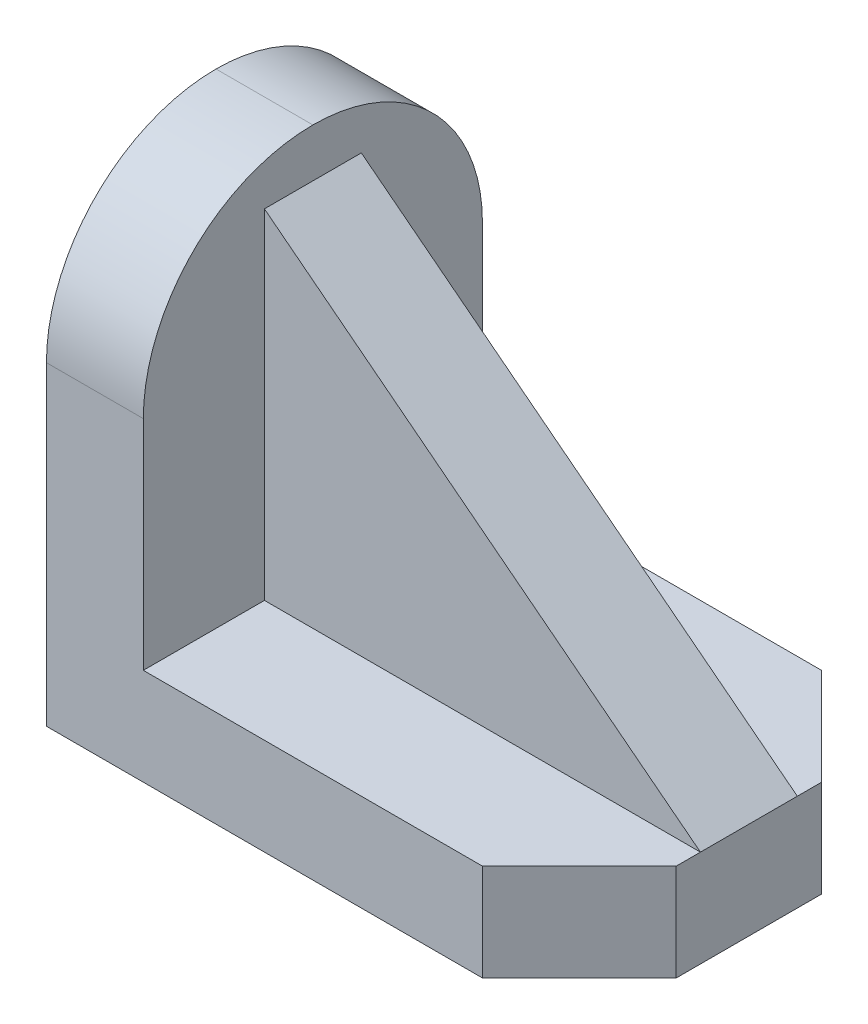
from build123d import *

# Parameters (mm, degrees)
SKETCH10_W          = 66000
SKETCH10_H          = 42000
BOSS_EXTRUDE3_DEPTH = 12000
CHAMFER1_SIZE       = 12000
SKETCH14_W          = 42000
SKETCH14_H          = 48000
BOSS_EXTRUDE6_DEPTH = 12000
FILLET1_R           = 21000
BOSS_EXTRUDE7_DEPTH = 6000


with BuildPart() as part:
    # Sketch10 → Boss-Extrude3 (new body)
    with BuildSketch(Plane(origin=(0, 0, 0), x_dir=(1, 0, 0), z_dir=(0, 1, 0))):
        Rectangle(SKETCH10_W, SKETCH10_H)
    extrude(amount=BOSS_EXTRUDE3_DEPTH)

    # Chamfer1
    chamfer1_edges = [part.edges().sort_by_distance(p)[0] for p in [
        (33000, 6000, 21000),
        (33000, 6000, -21000),
    ]]
    chamfer(chamfer1_edges, length=CHAMFER1_SIZE)



with BuildPart() as body_2:
    # Sketch14 → Boss-Extrude6 (new body)
    with BuildSketch(Plane.ZY.offset(33000)):
        with Locations((0, 36000)):
            Rectangle(SKETCH14_W, SKETCH14_H)
    extrude(amount=-BOSS_EXTRUDE6_DEPTH)

    # Fillet1
    fillet1_edges = [body_2.edges().sort_by_distance(p)[0] for p in [
        (-27000, 60000, 21000),
        (-27000, 60000, -21000),
    ]]
    fillet(fillet1_edges, radius=FILLET1_R - 0.0001)  # a hair under: the kernel refuses the full size


with BuildPart() as part_1:
    add(part.part)

    add(body_2.part)  # Boss-Extrude7 merges body 2
    # Sketch15 → Boss-Extrude7 (add, symmetric)
    with BuildSketch(Plane.XY):
        Polygon((-21000, 54000), (-21000, 12000), (33000, 12000), align=None)
    extrude(amount=BOSS_EXTRUDE7_DEPTH, both=True)


solid = part_1.part
